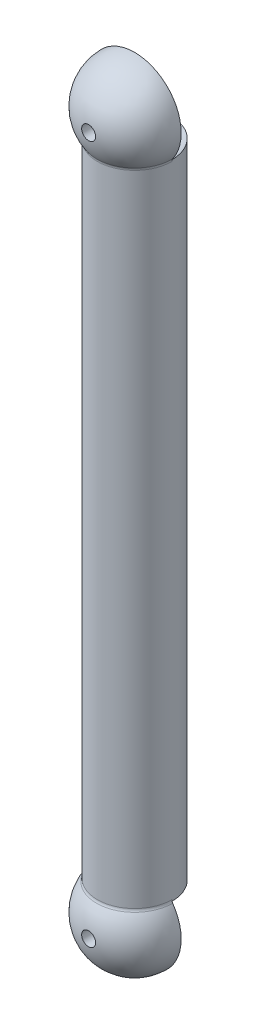
from build123d import *
from build123d.topology import SkipClean

# Parameters (mm, degrees)
REVOLVE1_ANGLE     = 180
SKETCH2_R          = 1.5
CUT_EXTRUDE1_DEPTH = 161.623784042
REVOLVE2_ANGLE     = 180
FILLET1_R          = 1


with BuildPart() as part:
    # Sketch1 → Revolve1 (revolve)
    with BuildSketch(Plane.XY):
        with BuildLine():
            Line((-8, 6), (-8, 144))
            ThreePointArc((-8, 144), (-8.94427191, 154.472135955), (0, 160))
            Line((0, 160), (0, -10))
            ThreePointArc((0, -10), (-8.94427191, -4.472135955), (-8, 6))
        make_face()
    revolve(axis=Axis((0, 0, 0), (0, 1, 0)), revolution_arc=REVOLVE1_ANGLE)

    # Sketch2 → Cut-Extrude1 (cut, through all)
    with BuildSketch(Plane(origin=(0, 0, 0), x_dir=(-1, 0, 0), z_dir=(0, 0, -1))):
        Circle(SKETCH2_R)
        with Locations((0, 150)):
            Circle(SKETCH2_R)
    extrude(amount=-CUT_EXTRUDE1_DEPTH, mode=Mode.SUBTRACT)

    # Sketch3 → Revolve2 (revolve)
    with SkipClean():  # the faces are left unmerged after this step: merging them gives an invalid solid
        with BuildSketch(Plane(origin=(0, 0, 0), x_dir=(-1, 0, 0), z_dir=(0, 0, -1))):
            with BuildLine():
                Line((0, 140), (0, 10))
                ThreePointArc((0, 10), (4.472135955, 8.94427191), (8, 6))
                Line((8, 6), (8, 144))
                ThreePointArc((8, 144), (4.472135955, 141.05572809), (0, 140))
            make_face()
        revolve(axis=Axis((0, 150, 0), (0, -1, 0)), revolution_arc=REVOLVE2_ANGLE)

    # Fillet1
    # the kernel refuses this fillet: 1 mm, written as the material it adds along each edge
    with BuildSketch(Plane(origin=(0, 6, 0), x_dir=(-1, 0, 0), z_dir=(0, 0, -1))) as fillet1_piece_1:
        with BuildLine():
            CenterArc((9, 0.32455532), FILLET1_R, 180, 35.096801228)
            Line((8, 0.32455532), (8, 0))
            ThreePointArc((8, 0), (8.091877748, -0.124498786), (8.181818182, -0.250404254))
        make_face()
    revolve(axis=Axis((0, 6, 0), (0, 1, 0)), revolution_arc=180)
    with BuildSketch(Plane(origin=(0, 144, 0), x_dir=(-1, 0, 0), z_dir=(0, 0, -1))) as fillet1_piece_2:
        with BuildLine():
            CenterArc((9, -0.32455532), FILLET1_R, 144.903198772, 35.096801228)
            ThreePointArc((8.181818182, 0.250404254), (8.091877748, 0.124498786), (8, 0))
            Line((8, 0), (8, -0.32455532))
        make_face()
    revolve(axis=Axis((0, 144, 0), (0, 1, 0)), revolution_arc=180)


solid = part.part
